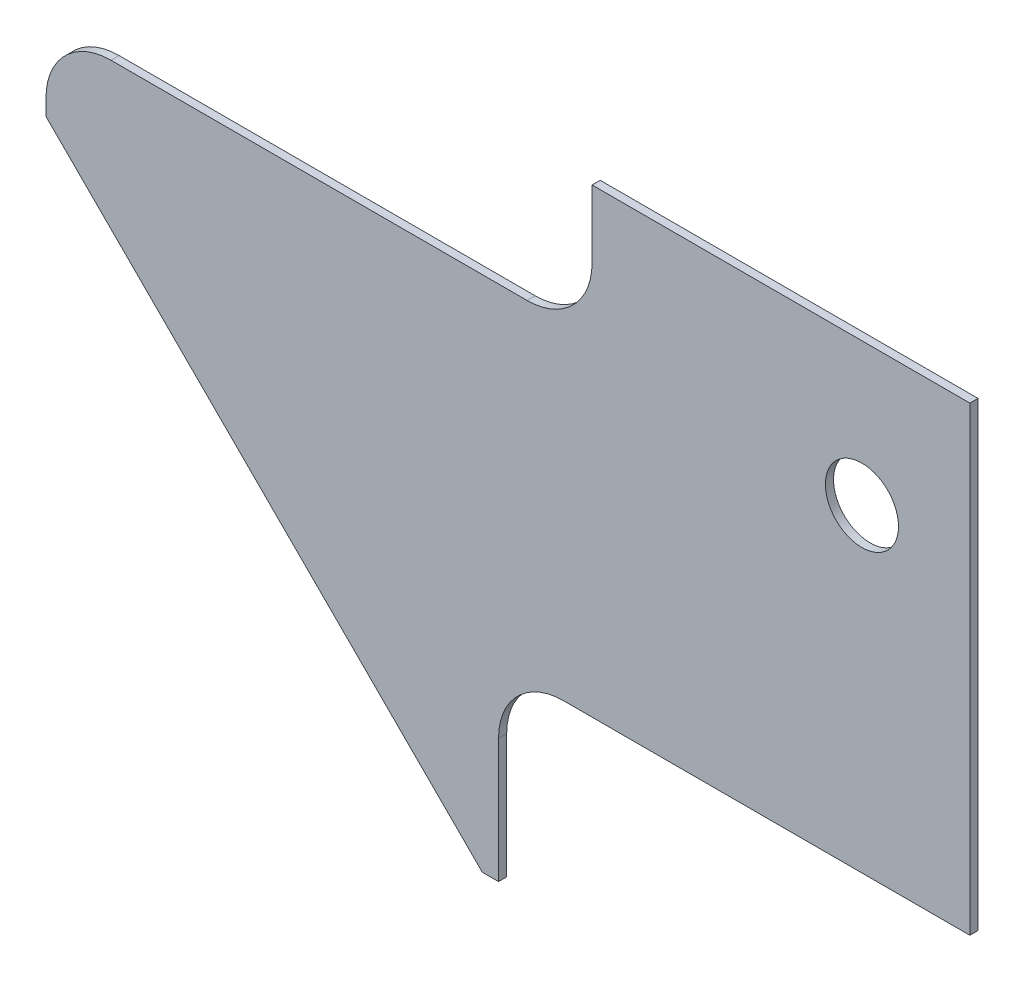
from build123d import *

# Parameters (mm, degrees)
SKETCH1_R           = 14.2875
BOSS_EXTRUDE1_DEPTH = 3.175
SKETCH2_W           = 184.202806358
SKETCH2_H           = 73.914
CUT_EXTRUDE1_DEPTH  = 266.893552722
FILLET1_R           = 25.4
SKETCH4_W           = 213.36
SKETCH4_H           = 64.479988722
CUT_EXTRUDE2_DEPTH  = 266.893552722
FILLET2_R           = 25.4
SKETCH7_W           = 147.610011278
SKETCH7_H           = 12.7
CUT_EXTRUDE4_DEPTH  = 266.893552722


with BuildPart() as part:
    # Sketch1 → Boss-Extrude1 (new body)
    with BuildSketch(Plane.XY):
        Polygon((-138.259383474, 48.991487021), (32.210627804, -121.478524257), (222.710627804, -121.478524257), (222.710627804, 145.221475743), (-138.259383474, 145.221475743), align=None)
        with Locations((180.538014078, 76.831975743)):
            Circle(SKETCH1_R, mode=Mode.SUBTRACT)
    extrude(amount=BOSS_EXTRUDE1_DEPTH)

    # Sketch2 → Cut-Extrude1 (cut, through all)
    with BuildSketch(Plane.XY.offset(3.175)):
        with Locations((130.662030983, -84.521524257)):
            Rectangle(SKETCH2_W, SKETCH2_H)
    extrude(amount=-CUT_EXTRUDE1_DEPTH, mode=Mode.SUBTRACT)

    # Fillet1
    fillet1_edges = [part.edges().sort_by_distance(p)[0] for p in [
        (38.560627804, -47.564524257, 1.5875),
    ]]
    fillet(fillet1_edges, radius=FILLET1_R)

    # Sketch4 → Cut-Extrude2 (cut, through all)
    with BuildSketch(Plane.XY.offset(3.175)):
        with Locations((-31.579383474, 112.981481382)):
            Rectangle(SKETCH4_W, SKETCH4_H)
    extrude(amount=-CUT_EXTRUDE2_DEPTH, mode=Mode.SUBTRACT)

    # Fillet2
    fillet2_edges = [part.edges().sort_by_distance(p)[0] for p in [
        (-138.259383474, 80.741487021, 1.5875),
        (75.100616526, 80.741487021, 1.5875),
    ]]
    fillet(fillet2_edges, radius=FILLET2_R)

    # Sketch7 → Cut-Extrude4 (cut, through all)
    with BuildSketch(Plane.XY.offset(3.175)):
        with Locations((148.905622165, 138.871475743)):
            Rectangle(SKETCH7_W, SKETCH7_H)
    extrude(amount=-CUT_EXTRUDE4_DEPTH, mode=Mode.SUBTRACT)


solid = part.part
